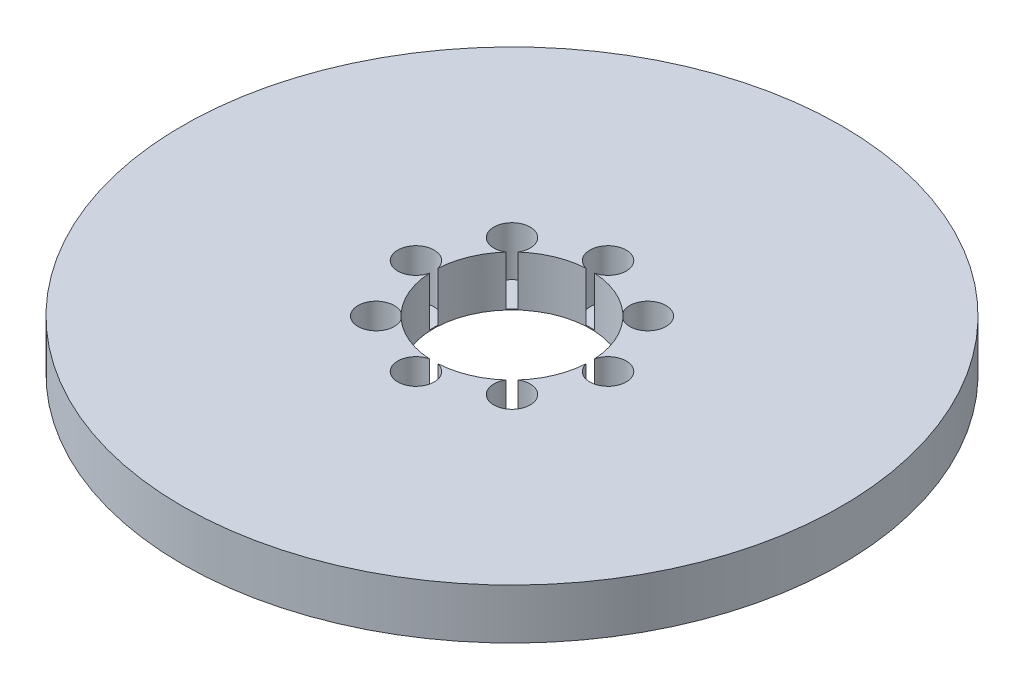
from build123d import *

# Parameters (mm, degrees)
SKETCH1_R           = 52.5
BOSS_EXTRUDE1_DEPTH = 8
SKETCH2_R           = 12.5
CUT_EXTRUDE1_DEPTH  = 75.675966683
SKETCH3_R           = 2.898893599
CUT_EXTRUDE2_DEPTH  = 7.850379141
CIRPATTERN1_COUNT   = 8


with BuildPart() as part:
    # Sketch1 → Boss-Extrude1 (new body)
    with BuildSketch(Plane(origin=(0, 0, 0), x_dir=(1, 0, 0), z_dir=(0, 1, 0))):
        Circle(SKETCH1_R)
    extrude(amount=BOSS_EXTRUDE1_DEPTH)

    # Sketch2 → Cut-Extrude1 (cut, through all)
    with BuildSketch(Plane(origin=(0, 0, 0), x_dir=(1, 0, 0), z_dir=(0, 1, 0))):
        Circle(SKETCH2_R)
    extrude(amount=CUT_EXTRUDE1_DEPTH, mode=Mode.SUBTRACT)

    # Sketch3 → Cut-Extrude2 (cut)
    with BuildSketch(Plane(origin=(0, 8, 0), x_dir=(1, 0, 0), z_dir=(0, 1, 0))):
        with Locations((-15.305468807, 0)):
            Circle(SKETCH3_R)
    cut_extrude2 = extrude(amount=-CUT_EXTRUDE2_DEPTH, mode=Mode.SUBTRACT)

    # CirPattern1: Cut-Extrude2 ×8 about axis
    cirpattern1_axis = Axis((0, 0, 0), (0, 1, 0))
    for i in range(1, CIRPATTERN1_COUNT):
        add(cut_extrude2.rotate(cirpattern1_axis, i * 360 / CIRPATTERN1_COUNT), mode=Mode.SUBTRACT)


solid = part.part
